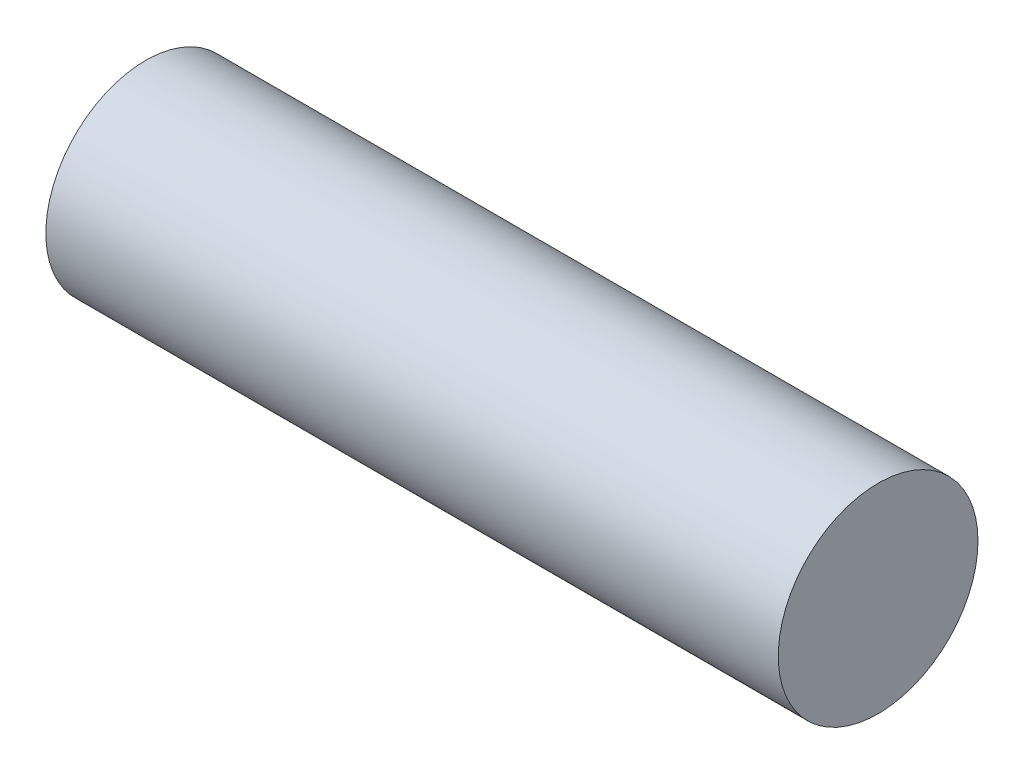
from build123d import *

# Parameters (mm, degrees)
SKETCH_1_R      = 1.5
EXTRUDE_1_DEPTH = 11


with BuildPart() as part:
    # 草图1 → 凸台-拉伸1 (new body)
    with BuildSketch(Plane(origin=(0, 0, 0), x_dir=(0, 0, -1), z_dir=(1, 0, 0))):
        Circle(SKETCH_1_R)
    extrude(amount=EXTRUDE_1_DEPTH)


solid = part.part
